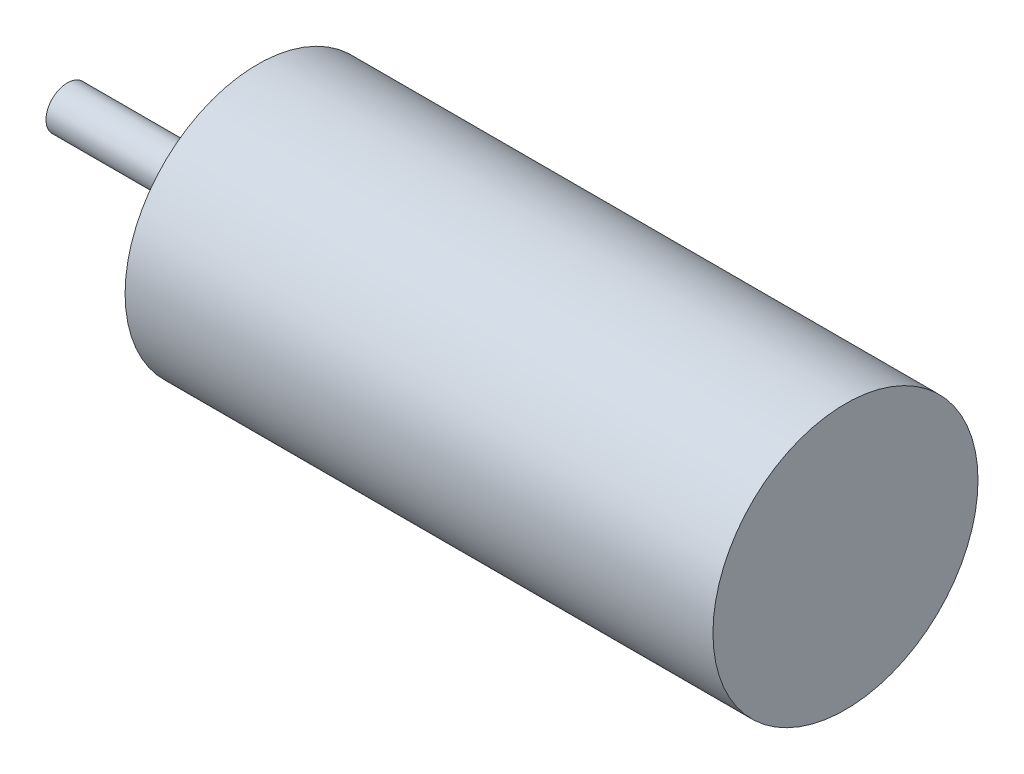
from build123d import *

# Parameters (mm, degrees)
SKETCH2_R          = 1.5
CUT_EXTRUDE1_DEPTH = 5


with BuildPart() as part:
    # Sketch1 → Revolve1 (revolve)
    with BuildSketch(Plane.XY):
        Polygon((0, 0), (72.8, 0), (72.8, 12.4), (17.8, 12.4), (17.8, 4), (15.5, 4), (15.5, 2), (0, 2), align=None)
    revolve(axis=Axis((0, 0, 0), (1, 0, 0)))

    # Sketch2 → Cut-Extrude1 (cut)
    with BuildSketch(Plane.ZY.offset(-17.8)):
        with Locations((0, 8.5)):
            Circle(SKETCH2_R)
        with Locations((0, -8.5)):
            Circle(SKETCH2_R)
    extrude(amount=-CUT_EXTRUDE1_DEPTH, mode=Mode.SUBTRACT)


solid = part.part
